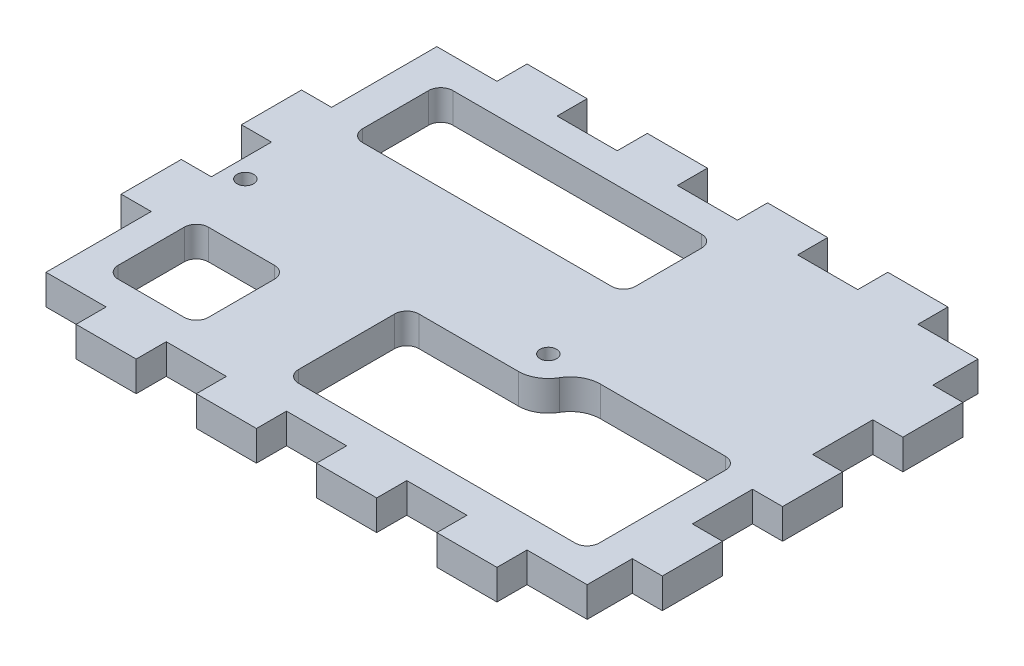
from build123d import *

# Parameters (mm, degrees)
SKETCH1_W           = 431.8
SKETCH1_H           = 95.25
BOSS_EXTRUDE1_DEPTH = 6.35
SKETCH2_W           = 12.7
SKETCH2_H           = 6.35
CUT_EXTRUDE1_DEPTH  = 443.226327801
LPATTERN1_COUNT     = 17
LPATTERN1_PITCH     = 25.4
SKETCH3_W           = 6.35
SKETCH3_H           = 6.35
CUT_EXTRUDE2_DEPTH  = 443.226327801
SKETCH5_W           = 6.35
SKETCH5_H           = 12.7
CUT_EXTRUDE4_DEPTH  = 443.226327801
LPATTERN2_COUNT     = 2
LPATTERN2_PITCH     = 25.4
LPATTERN2_COL_COUNT = 2
LPATTERN2_COL_PITCH = 25.4
SKETCH6_W           = 114.3
SKETCH6_H           = 46.0375
CUT_EXTRUDE5_DEPTH  = 443.226327801
SKETCH7_R           = 1.75
CUT_EXTRUDE6_DEPTH  = 443.226327801
SKETCH8_W           = 6.35
SKETCH8_H           = 9.525
SKETCH8_H_2         = 12.7
CUT_EXTRUDE7_DEPTH  = 443.226327801
LPATTERN3_COUNT     = 2
LPATTERN3_PITCH     = 425.45
SKETCH9_W           = 304.8
SKETCH9_H           = 95.25
CUT_EXTRUDE8_DEPTH  = 443.226327801
SKETCH10_W          = 6.35
SKETCH10_H          = 15.875
CUT_EXTRUDE9_DEPTH  = 443.226327801
SKETCH11_W          = 57.65
SKETCH11_H          = 19.05
CUT_EXTRUDE10_DEPTH = 443.226327801
SKETCH12_W          = 63.5
SKETCH12_H          = 25.4
CUT_EXTRUDE11_DEPTH = 443.226327801
SKETCH13_W          = 19.05
SKETCH13_H          = 19.05
CUT_EXTRUDE12_DEPTH = 443.226327801
SKETCH14_W          = 33.6
SKETCH14_H          = 6.35
CUT_EXTRUDE13_DEPTH = 443.226327801
FILLET1_R           = 6.35
FILLET2_R           = 6.35
FILLET3_R           = 2.54


with BuildPart() as part:
    # Sketch1 → Boss-Extrude1 (new body)
    with BuildSketch(Plane(origin=(0, 0, 0), x_dir=(1, 0, 0), z_dir=(0, 1, 0))):
        with Locations((215.9, 47.625)):
            Rectangle(SKETCH1_W, SKETCH1_H)
    extrude(amount=BOSS_EXTRUDE1_DEPTH)

    # Sketch2 → Cut-Extrude1 (cut, through all)
    with BuildSketch(Plane(origin=(0, 6.35, 0), x_dir=(1, 0, 0), z_dir=(0, 1, 0))):
        with Locations((12.7, 92.075)):
            Rectangle(SKETCH2_W, SKETCH2_H)
        with Locations((12.7, 3.175)):
            Rectangle(SKETCH2_W, SKETCH2_H)
    cut_extrude1 = extrude(amount=-CUT_EXTRUDE1_DEPTH, mode=Mode.SUBTRACT)

    # LPattern1: Cut-Extrude1 ×17
    with Locations(*[(i * LPATTERN1_PITCH, 0, 0) for i in range(1, LPATTERN1_COUNT)]):
        add(cut_extrude1, mode=Mode.SUBTRACT)

    # Sketch3 → Cut-Extrude2 (cut, through all)
    with BuildSketch(Plane(origin=(0, 6.35, 0), x_dir=(1, 0, 0), z_dir=(0, 1, 0))):
        with Locations((3.175, 92.075)):
            Rectangle(SKETCH3_W, SKETCH3_H)
        with Locations((3.175, 3.175)):
            Rectangle(SKETCH3_W, SKETCH3_H)
        with Locations((428.625, 92.075)):
            Rectangle(SKETCH3_W, SKETCH3_H)
        with Locations((428.625, 3.175)):
            Rectangle(SKETCH3_W, SKETCH3_H)
    extrude(amount=-CUT_EXTRUDE2_DEPTH, mode=Mode.SUBTRACT)

    # Sketch5 → Cut-Extrude4 (cut, through all)
    with BuildSketch(Plane(origin=(0, 6.35, 0), x_dir=(1, 0, 0), z_dir=(0, 1, 0))):
        with Locations((187.325, 47.625)):
            Rectangle(SKETCH5_W, SKETCH5_H)
        with Locations((307.975, 47.625)):
            Rectangle(SKETCH5_W, SKETCH5_H)
    cut_extrude4 = extrude(amount=-CUT_EXTRUDE4_DEPTH, mode=Mode.SUBTRACT)

    # LPattern2: Cut-Extrude4 ×2
    with Locations(*[(0, 0, -i * LPATTERN2_PITCH) for i in range(1, LPATTERN2_COUNT)]):
        add(cut_extrude4, mode=Mode.SUBTRACT)

    # LPattern2 col: Cut-Extrude4 ×2
    with Locations(*[(0, 0, i * LPATTERN2_COL_PITCH) for i in range(1, LPATTERN2_COL_COUNT)]):
        add(cut_extrude4, mode=Mode.SUBTRACT)

    # Sketch6 → Cut-Extrude5 (cut, through all)
    with BuildSketch(Plane(origin=(0, 6.35, 0), x_dir=(1, 0, 0), z_dir=(0, 1, 0))):
        with Locations((247.65, 47.625)):
            Rectangle(SKETCH6_W, SKETCH6_H)
    extrude(amount=-CUT_EXTRUDE5_DEPTH, mode=Mode.SUBTRACT)

    # Sketch7 → Cut-Extrude6 (cut, through all)
    with BuildSketch(Plane(origin=(0, 6.35, 0), x_dir=(1, 0, 0), z_dir=(0, 1, 0))):
        with Locations(Location((52.65, 44.45, 0), (0, 0, 270))):
            Circle(SKETCH7_R)
        with Locations(Location((116.65, 44.45, 0), (0, 0, 270))):
            Circle(SKETCH7_R)
        with Locations(Location((315.15, 44.45, 0), (0, 0, 270))):
            Circle(SKETCH7_R)
        with Locations(Location((379.15, 44.45, 0), (0, 0, 270))):
            Circle(SKETCH7_R)
    extrude(amount=-CUT_EXTRUDE6_DEPTH, mode=Mode.SUBTRACT)

    # Sketch8 → Cut-Extrude7 (cut, through all)
    with BuildSketch(Plane(origin=(0, 6.35, 0), x_dir=(1, 0, 0), z_dir=(0, 1, 0))):
        with Locations((3.175, 84.1375)):
            Rectangle(SKETCH8_W, SKETCH8_H)
        with Locations((3.175, 11.1125)):
            Rectangle(SKETCH8_W, SKETCH8_H)
        with Locations((3.175, 34.925)):
            Rectangle(SKETCH8_W, SKETCH8_H_2)
        with Locations((3.175, 60.325)):
            Rectangle(SKETCH8_W, SKETCH8_H_2)
    cut_extrude7 = extrude(amount=-CUT_EXTRUDE7_DEPTH, mode=Mode.SUBTRACT)

    # LPattern3: Cut-Extrude7 ×2
    with Locations(*[(i * LPATTERN3_PITCH, 0, 0) for i in range(1, LPATTERN3_COUNT)]):
        add(cut_extrude7, mode=Mode.SUBTRACT)

    # Sketch9 → Cut-Extrude8 (cut, through all)
    with BuildSketch(Plane(origin=(0, 6.35, 0), x_dir=(1, 0, 0), z_dir=(0, 1, 0))):
        with Locations((152.4, 47.625)):
            Rectangle(SKETCH9_W, SKETCH9_H)
    extrude(amount=-CUT_EXTRUDE8_DEPTH, mode=Mode.SUBTRACT)

    # Sketch10 → Cut-Extrude9 (cut, through all)
    with BuildSketch(Plane(origin=(0, 6.35, 0), x_dir=(1, 0, 0), z_dir=(0, 1, 0))):
        with Locations((307.975, 87.3125)):
            Rectangle(SKETCH10_W, SKETCH10_H)
        with Locations((307.975, 7.9375)):
            Rectangle(SKETCH10_W, SKETCH10_H)
    extrude(amount=-CUT_EXTRUDE9_DEPTH, mode=Mode.SUBTRACT)

    # Sketch11 → Cut-Extrude10 (cut, through all)
    with BuildSketch(Plane(origin=(0, 6.35, 0), x_dir=(1, 0, 0), z_dir=(0, 1, 0))):
        with Locations((347.15, 73.025)):
            Rectangle(SKETCH11_W, SKETCH11_H)
    extrude(amount=-CUT_EXTRUDE10_DEPTH, mode=Mode.SUBTRACT)

    # Sketch12 → Cut-Extrude11 (cut, through all)
    with BuildSketch(Plane(origin=(0, 6.35, 0), x_dir=(1, 0, 0), z_dir=(0, 1, 0))):
        with Locations((387.35, 25.4)):
            Rectangle(SKETCH12_W, SKETCH12_H)
    extrude(amount=-CUT_EXTRUDE11_DEPTH, mode=Mode.SUBTRACT)

    # Sketch13 → Cut-Extrude12 (cut, through all)
    with BuildSketch(Plane(origin=(0, 6.35, 0), x_dir=(1, 0, 0), z_dir=(0, 1, 0))):
        with Locations((327.025, 22.225)):
            Rectangle(SKETCH13_W, SKETCH13_H)
    extrude(amount=-CUT_EXTRUDE12_DEPTH, mode=Mode.SUBTRACT)

    # Sketch14 → Cut-Extrude13 (cut, through all)
    with BuildSketch(Plane(origin=(0, 6.35, 0), x_dir=(1, 0, 0), z_dir=(0, 1, 0))):
        with Locations((402.3, 41.275)):
            Rectangle(SKETCH14_W, SKETCH14_H)
    extrude(amount=-CUT_EXTRUDE13_DEPTH, mode=Mode.SUBTRACT)

    # Fillet1
    fillet1_edges = [part.edges().sort_by_distance(p)[0] for p in [
        (385.5, 3.175, -38.1),
    ]]
    fillet(fillet1_edges, radius=FILLET1_R - 0.0001)  # a hair under: the kernel refuses the full size

    # Fillet2
    fillet2_edges = [part.edges().sort_by_distance(p)[0] for p in [
        (385.5, 3.175, -44.45),
    ]]
    fillet(fillet2_edges, radius=FILLET2_R)

    # Fillet3
    fillet3_edges = [part.edges().sort_by_distance(p)[0] for p in [
        (318.325, 3.175, -63.5),
        (318.325, 3.175, -82.55),
        (375.975, 3.175, -82.55),
        (375.975, 3.175, -63.5),
        (419.1, 3.175, -12.7),
        (355.6, 3.175, -12.7),
        (355.6, 3.175, -38.1),
        (317.5, 3.175, -12.7),
        (317.5, 3.175, -31.75),
        (336.55, 3.175, -31.75),
        (336.55, 3.175, -12.7),
        (419.1, 3.175, -44.45),
    ]]
    fillet(fillet3_edges, radius=FILLET3_R)


solid = part.part
